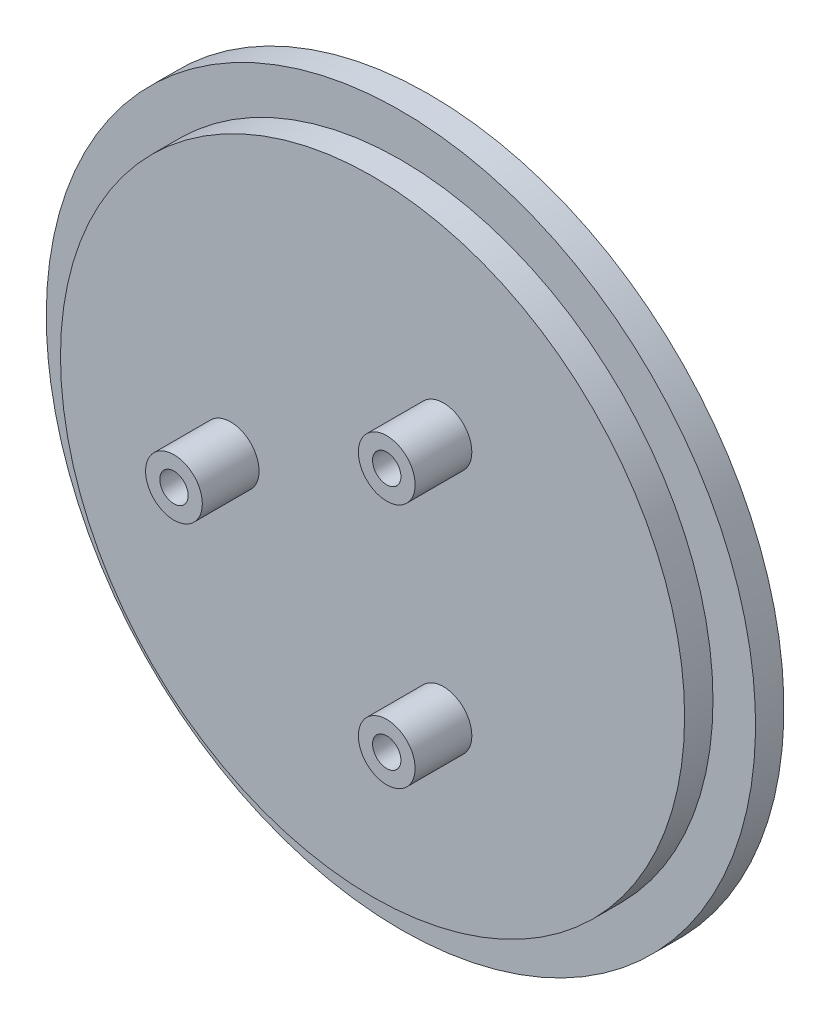
from build123d import *

# Parameters (mm, degrees)
SKETCH_1_R          = 22
EXTRUDE_1_DEPTH     = 2
SKETCH_2_R          = 2
SKETCH_2_R_2        = 1
EXTRUDE_2_DEPTH     = 4
SKETCH_3_R          = 25
EXTRUDE_3_DEPTH     = 2
CUT_EXTRUDE_1_DEPTH = 2
SKETCH_5_W          = 7.301488753
SKETCH_5_H          = 7.9
CUT_EXTRUDE_2_DEPTH = 1


with BuildPart() as part:
    # 草图1 → 凸台-拉伸1 (new body)
    with BuildSketch(Plane.XY):
        Circle(SKETCH_1_R)
    extrude(amount=EXTRUDE_1_DEPTH)

    # 草图2 → 凸台-拉伸2 (add)
    # profile 1 of 3: a face of its own
    with BuildSketch(Plane.XY.offset(2)):
        with Locations((-10, 0)):
            Circle(SKETCH_2_R)
        with Locations((-10, 0)):
            Circle(SKETCH_2_R_2, mode=Mode.SUBTRACT)
    # profile 2 of 3: a face of its own
    with BuildSketch(Plane.XY.offset(2)):
        with Locations((5, 8.660254038)):
            Circle(SKETCH_2_R)
        with Locations((5, 8.660254038)):
            Circle(SKETCH_2_R_2, mode=Mode.SUBTRACT)
    # profile 3 of 3: a face of its own
    with BuildSketch(Plane.XY.offset(2)):
        with Locations((5, -8.660254038)):
            Circle(SKETCH_2_R)
        with Locations((5, -8.660254038)):
            Circle(SKETCH_2_R_2, mode=Mode.SUBTRACT)
    extrude(amount=EXTRUDE_2_DEPTH)

    # 草图3 → 凸台-拉伸3 (add)
    with BuildSketch(Plane(origin=(0, 0, 0), x_dir=(-1, 0, 0), z_dir=(0, 0, -1))):
        Circle(SKETCH_3_R)
    extrude(amount=EXTRUDE_3_DEPTH)

    # 草图4 → 切除-拉伸1 (cut)
    with BuildSketch(Plane(origin=(0, 0, -2), x_dir=(-1, 0, 0), z_dir=(0, 0, -1))):
        with BuildLine():
            Line((-7.25, 3.95), (7.25, 3.95))
            ThreePointArc((7.25, 3.95), (11.2, 0), (7.25, -3.95))
            Line((7.25, -3.95), (-7.25, -3.95))
            ThreePointArc((-7.25, -3.95), (-11.2, 0), (-7.25, 3.95))
        make_face()
    extrude(amount=-CUT_EXTRUDE_1_DEPTH, mode=Mode.SUBTRACT)

    # 草图5 → 切除-拉伸2 (cut)
    with BuildSketch(Plane(origin=(0, 0, -2), x_dir=(-1, 0, 0), z_dir=(0, 0, -1))):
        with Locations((24.650744377, 0)):
            Rectangle(SKETCH_5_W, SKETCH_5_H)
    extrude(amount=-CUT_EXTRUDE_2_DEPTH, mode=Mode.SUBTRACT)


solid = part.part
